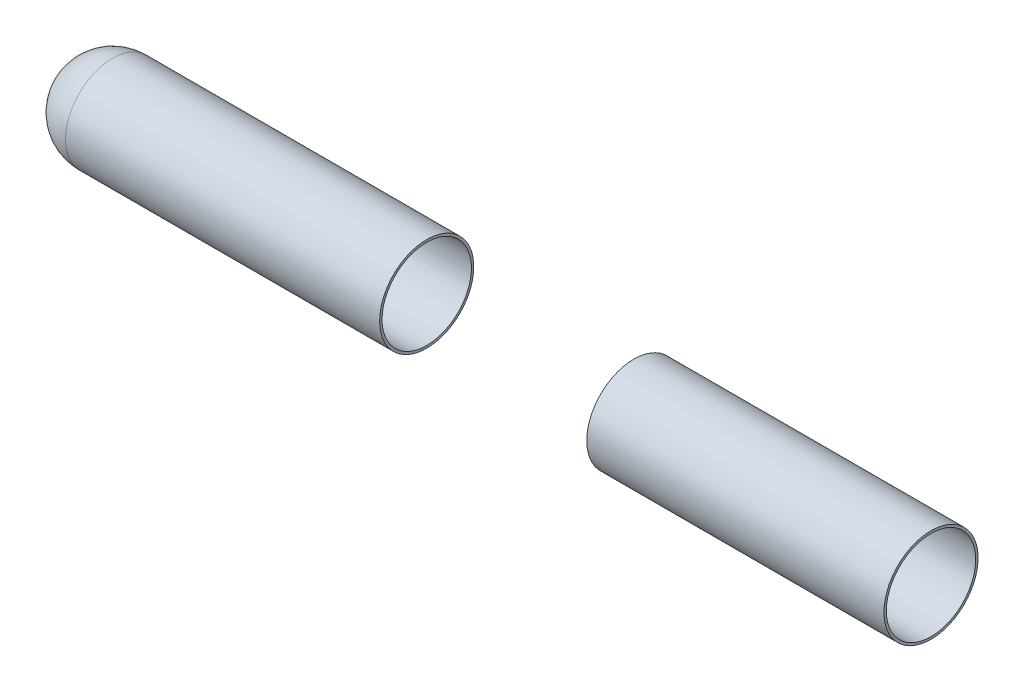
from build123d import *

# Parameters (mm, degrees)
CUT_EXTRUDE1_DEPTH      = 662.525604191
CUT_EXTRUDE1_DEPTH_BACK = 662.525604191
SKETCH2_W               = 76.2
SKETCH2_H               = 63.5
SKETCH2_W_2             = 139.7


with BuildPart() as part:
    # rootSketch → Revolve1 (revolve)
    with BuildSketch(Plane(origin=(0, 0, 0), x_dir=(1, 0, 0), z_dir=(0, 1, 0))):
        with BuildLine():
            Line((31.75, -31.75), (660, -31.75))
            Line((660, -31.75), (660, -30.1498))
            Line((660, -30.1498), (660, 0))
            Line((660, 0), (1.6002, 0))
            Line((1.6002, 0), (0, 0))
            ThreePointArc((0, 0), (9.299359697, -22.450640303), (31.75, -31.75))
        make_face()
    revolve(axis=Axis((0, 0, 0), (1, 0, 0)))

    # Sketch1 → Cut-Revolve1 (revolve, cut)
    with BuildSketch(Plane(origin=(0, 0, 0), x_dir=(1, 0, 0), z_dir=(0, 1, 0))):
        with BuildLine():
            Line((660, 0), (660, -30.1498))
            Line((660, -30.1498), (31.75, -30.1498))
            ThreePointArc((31.75, -30.1498), (10.430871969, -21.319128031), (1.6002, 0))
            Line((1.6002, 0), (660, 0))
        make_face()
    revolve(axis=Axis((1.6002, 0, 0), (1, 0, 0)), mode=Mode.SUBTRACT)

    # Sketch2 → Cut-Extrude1 (cut, two sides: drawn at the far end of the back side and taken through both)
    with BuildSketch(Plane(origin=(0, 0, 0), x_dir=(1, 0, 0), z_dir=(0, 1, 0)).offset(-CUT_EXTRUDE1_DEPTH_BACK)):
        with Locations((621.9, 0)):
            Rectangle(SKETCH2_W, SKETCH2_H)
        with Locations((313.5, 0)):
            Rectangle(SKETCH2_W_2, SKETCH2_H)
    extrude(amount=CUT_EXTRUDE1_DEPTH + CUT_EXTRUDE1_DEPTH_BACK, mode=Mode.SUBTRACT)


with BuildPart() as cut_extrude1_piece_1:
    # of the separate pieces the step leaves, piece 1, a body of its own (cut_extrude1_pieces)
    add(part.part.solids().sort_by_distance((0, 0, 0))[0])


with BuildPart() as cut_extrude1_piece_2:
    # of the separate pieces the step leaves, piece 2, a body of its own (cut_extrude1_pieces)
    add(part.part.solids().sort_by_distance((383.35, 0, 31.75))[0])


solid = Compound([cut_extrude1_piece_1.part, cut_extrude1_piece_2.part])
